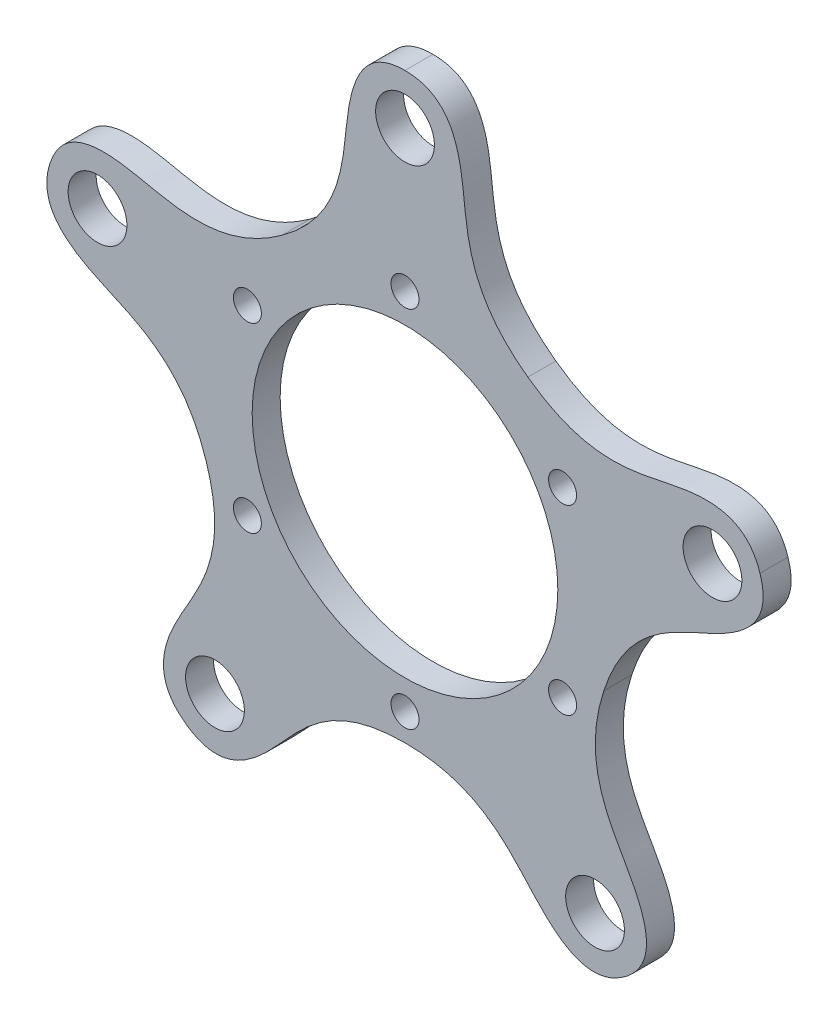
from build123d import *

# Parameters (mm, degrees)
SKETCH1_R           = 63.5
SKETCH1_R_2         = 26
BOSS_EXTRUDE1_DEPTH = 4.7625
SKETCH2_R           = 2.38125
CUT_EXTRUDE1_DEPTH  = 90.928757393
CIRPATTERN1_COUNT   = 6
SKETCH3_R           = 5
CUT_EXTRUDE2_DEPTH  = 90.928757393
CIRPATTERN2_COUNT   = 5
CUT_EXTRUDE3_DEPTH  = 4.7625
CIRPATTERN3_COUNT   = 5


# Read off the part's stored shape, not the designer's step: Cut-Extrude3
with BuildPart() as part:
    # Sketch1 → Boss-Extrude1 (new body)
    with BuildSketch(Plane.XY):
        with Locations(Location((0, 0, 0), (0, 0, 180))):
            Circle(SKETCH1_R)
        with Locations(Location((0, 0, 0), (0, 0, 180))):
            Circle(SKETCH1_R_2, mode=Mode.SUBTRACT)
    extrude(amount=BOSS_EXTRUDE1_DEPTH)

    # Sketch2 → Cut-Extrude1 (cut, through all)
    with BuildSketch(Plane.XY):
        with Locations(Location((0, 30.95625, 0), (0, 0, 180))):
            Circle(SKETCH2_R)
    cut_extrude1 = extrude(amount=CUT_EXTRUDE1_DEPTH, mode=Mode.SUBTRACT)

    # CirPattern1: Cut-Extrude1 ×6 about axis
    cirpattern1_axis = Axis((0, 0, 0), (0, 0, 1))
    for i in range(1, CIRPATTERN1_COUNT):
        add(cut_extrude1.rotate(cirpattern1_axis, i * 360 / CIRPATTERN1_COUNT), mode=Mode.SUBTRACT)

    # Sketch3 → Cut-Extrude2 (cut, through all)
    with BuildSketch(Plane.XY):
        with Locations(Location((0, 55, 0), (0, 0, 180))):
            Circle(SKETCH3_R)
    cut_extrude2 = extrude(amount=CUT_EXTRUDE2_DEPTH, mode=Mode.SUBTRACT)

    # CirPattern2: Cut-Extrude2 ×5 about axis
    cirpattern2_axis = Axis((0, 0, 0), (0, 0, 1))
    for i in range(1, CIRPATTERN2_COUNT):
        add(cut_extrude2.rotate(cirpattern2_axis, i * 360 / CIRPATTERN2_COUNT), mode=Mode.SUBTRACT)

    # Cut-Extrude3 outline → Cut-Extrude3 (cut)
    with BuildSketch(Plane.XY):
        with BuildLine():
            ThreePointArc((0, 63.5), (-37.324363521, 51.372579143), (-60.392088785, 19.622579143))
            add(Edge.make_bspline(
                [(-60.392088785, 19.622579143), (-58.360099264, 25.876399839), (-51.763003105, 26.513815146), (-38.996790379, 23.789333877), (-30.112449339, 22.076602213), (-11.690837804, 35.460686427), (-10.574330049, 44.439460058), (-9.220489027, 57.422760872), (-6.575656219, 63.5), (0, 63.5)],
                knots=[0, 0, 0, 0, 0.432208684, 0.532208684, 1, 1, 1.467791316, 1.567791316, 2, 2, 2, 2], degree=3))
        make_face()
    cut_extrude3 = extrude(amount=CUT_EXTRUDE3_DEPTH, mode=Mode.SUBTRACT)

    # CirPattern3: Cut-Extrude3 ×5 about axis
    cirpattern3_axis = Axis((0, 0, 4.7625), (0, 0, -1))
    for i in range(1, CIRPATTERN3_COUNT):
        add(cut_extrude3.rotate(cirpattern3_axis, i * 360 / CIRPATTERN3_COUNT), mode=Mode.SUBTRACT)


solid = part.part
